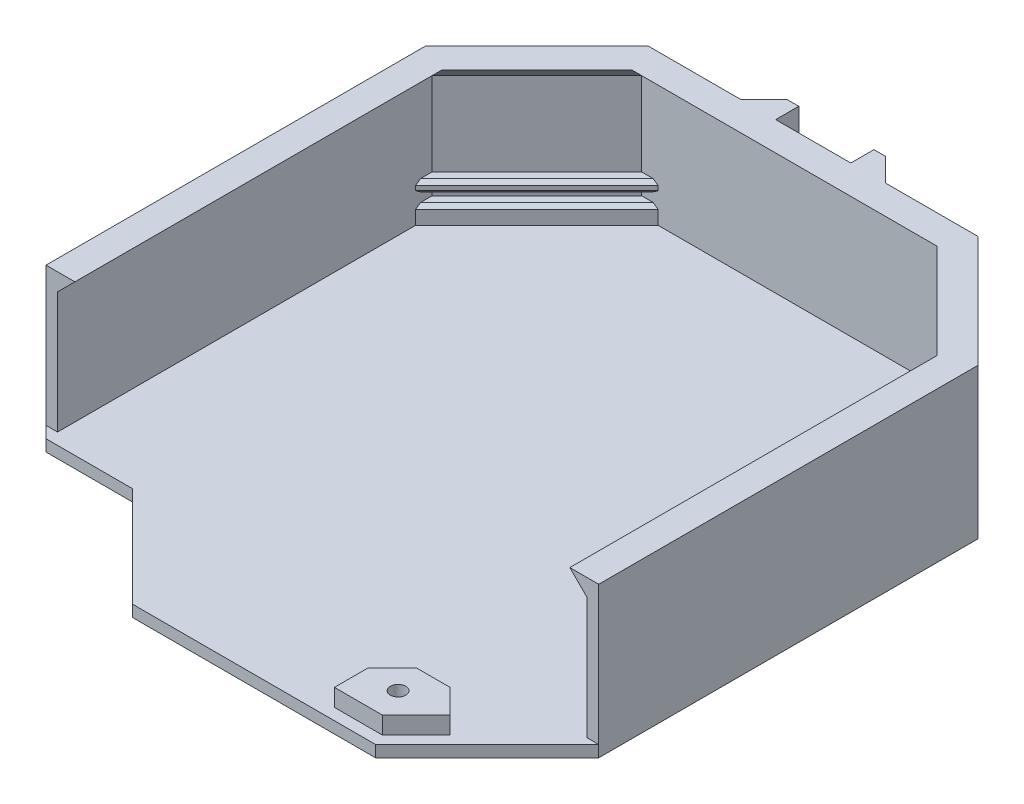
from build123d import *

# Parameters (mm, degrees)
BOSS_EXTRUDE1_DEPTH  = 2.54
BOSS_EXTRUDE2_DEPTH  = 30.48
CUT_EXTRUDE2_DEPTH   = 95.827847835
BOSS_EXTRUDE4_DEPTH  = 3.81
BOSS_EXTRUDE5_START  = 2
BOSS_EXTRUDE5_DEPTH  = 2.54
CHAMFER4_SIZE        = 0.762
BOSS_EXTRUDE6_DEPTH  = 3.81
M3_CLEARANCE_HOLE1_D = 3.4
SKETCH13_R           = 4.445
CUT_EXTRUDE3_DEPTH   = 2.032
BOSS_EXTRUDE3_DEPTH  = 3.81
CHAMFER2_SIZE        = 3.81
BOSS_EXTRUDE10_DEPTH = 33.02


with BuildPart() as part:
    # Sketch1 → Boss-Extrude1 (new body)
    with BuildSketch(Plane(origin=(0, 0, 0), x_dir=(1, 0, 0), z_dir=(0, 1, 0))):
        Polygon((-36.195, 66.167), (36.195, 66.167), (60.706, 41.656), (60.706, -41.656), (36.195, -66.167), (-36.195, -66.167), (-60.706, -41.656), (-60.706, 41.656), align=None)
    extrude(amount=BOSS_EXTRUDE1_DEPTH)

    # Sketch5 → Boss-Extrude2 (add)
    with BuildSketch(Plane(origin=(0, 2.54, 0), x_dir=(1, 0, 0), z_dir=(0, 1, 0))):
        Polygon((60.706, -41.656), (60.706, 41.656), (36.195, 66.167), (-36.195, 66.167), (-60.706, 41.656), (-60.706, -41.656), (-58.166, -41.656), (-58.166, 40.603897552), (-35.142897552, 63.627), (35.142897552, 63.627), (58.166, 40.603897552), (58.166, -41.656), align=None)
    extrude(amount=BOSS_EXTRUDE2_DEPTH)

    # Sketch8 → Cut-Extrude2 (cut, through all)
    with BuildSketch(Plane(origin=(0, 2.54, 0), x_dir=(1, 0, 0), z_dir=(0, 1, 0))):
        Polygon((-58.166, -44.196), (-36.195, -66.167), (-17.145, -66.167), (-39.116, -44.196), align=None)
    extrude(amount=-CUT_EXTRUDE2_DEPTH, mode=Mode.SUBTRACT)

    # Sketch9 → Boss-Extrude4 (add)
    with BuildSketch(Plane(origin=(0, 6.35, 0), x_dir=(1, 0, 0), z_dir=(0, 1, 0))):
        Polygon((-58.166, 40.603897552), (-35.142897552, 63.627), (-31.550795103, 63.627), (-58.166, 37.011795103), align=None)
        Polygon((31.550795103, 63.627), (58.166, 37.011795103), (58.166, 40.603897552), (35.142897552, 63.627), align=None)
    extrude(amount=-BOSS_EXTRUDE4_DEPTH)

    # Sketch9<3> → Boss-Extrude5 (add)
    with BuildSketch(Plane(origin=(0, 6.35, 0), x_dir=(1, 0, 0), z_dir=(0, 1, 0)).offset(BOSS_EXTRUDE5_START)):
        Polygon((-58.166, 40.603897552), (-35.142897552, 63.627), (-31.550795103, 63.627), (-58.166, 37.011795103), align=None)
        Polygon((31.550795103, 63.627), (58.166, 37.011795103), (58.166, 40.603897552), (35.142897552, 63.627), align=None)
    extrude(amount=BOSS_EXTRUDE5_DEPTH)

    # Chamfer4
    chamfer4_edges = [part.edges().sort_by_distance(p)[0] for p in [
        (-44.858397552, 10.89, -50.319397552),
        (-44.858397552, 8.35, -50.319397552),
        (44.858397552, 10.89, -50.319397552),
        (44.858397552, 8.35, -50.319397552),
        (-44.858397552, 6.35, -50.319397552),
        (44.858397552, 6.35, -50.319397552),
    ]]
    chamfer(chamfer4_edges, length=CHAMFER4_SIZE)

    # Sketch10 → Boss-Extrude6 (add)
    with BuildSketch(Plane(origin=(0, 2.54, 0), x_dir=(1, 0, 0), z_dir=(0, 1, 0))):
        Polygon((42.582385309, -56.187512242), (35.142897552, -63.627), (24.621873067, -63.627), (24.621873067, -56.187512242), (29.882385309, -50.927), (37.321873067, -50.927), align=None)
    extrude(amount=BOSS_EXTRUDE6_DEPTH)

    # M3 Clearance Hole1 (through all)
    with Locations(Plane(origin=(0, 6.35, 0), x_dir=(1, 0, 0), z_dir=(0, 1, 0))):
        with Locations((32.258, -57.277)):
            Hole(M3_CLEARANCE_HOLE1_D / 2)

    # Sketch13 → Cut-Extrude3 (cut)
    with BuildSketch(Plane.XZ):
        with Locations(Location((32.258, 57.277, 0), (0, 0, 270))):
            Circle(SKETCH13_R)
    extrude(amount=-CUT_EXTRUDE3_DEPTH, mode=Mode.SUBTRACT)

    # Sketch7 → Boss-Extrude3 (add)
    with BuildSketch(Plane(origin=(0, 33.02, 0), x_dir=(1, 0, 0), z_dir=(0, 1, 0))):
        Polygon((-58.166, -41.656), (-54.356, -41.656), (-54.356, 39.025743879), (-33.564743879, 59.817), (33.564743879, 59.817), (54.356, 39.025743879), (54.356, -41.656), (58.166, -41.656), (58.166, 40.603897552), (35.142897552, 63.627), (-35.142897552, 63.627), (-58.166, 40.603897552), align=None)
    extrude(amount=-BOSS_EXTRUDE3_DEPTH)

    # Chamfer2
    chamfer2_edges = [part.edges().sort_by_distance(p)[0] for p in [
        (54.356, 29.21, 1.315128061),
        (43.960371939, 29.21, -49.421371939),
        (0, 29.21, -59.817),
        (-43.960371939, 29.21, -49.421371939),
        (-54.356, 29.21, 1.315128061),
    ]]
    chamfer(chamfer2_edges, length=CHAMFER2_SIZE - 0.0001)  # a hair under: the kernel refuses the full size

    # Sketch14 → Boss-Extrude10 (add)
    with BuildSketch(Plane.XZ):
        Polygon((-8.255, -66.167), (-8.255, -71.247), (-10.795, -71.247), (-15.875, -66.167), align=None)
        Polygon((10.795, -71.247), (15.875, -66.167), (8.255, -66.167), (8.255, -71.247), align=None)
    extrude(amount=-BOSS_EXTRUDE10_DEPTH)


solid = part.part
